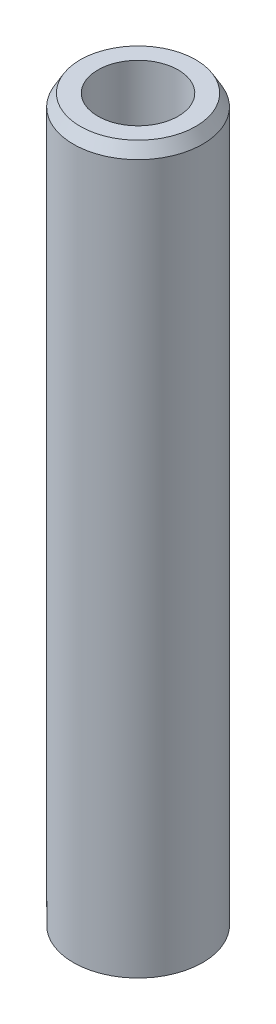
from build123d import *
from OCP.BRepFilletAPI import BRepFilletAPI_MakeChamfer

# Parameters (mm, degrees)
SKETCH1_R           = 25
BOSS_EXTRUDE1_DEPTH = 281.291442131
SKETCH2_R           = 15.524501488
CUT_EXTRUDE1_DEPTH  = 284.504630325
CHAMFER1_SIZE       = 4.627964847
CHAMFER1_SIZE2      = 2.67195675


with BuildPart() as part:
    # Sketch1 → Boss-Extrude1 (new body)
    with BuildSketch(Plane(origin=(0, 0, 0), x_dir=(1, 0, 0), z_dir=(0, 1, 0))):
        Circle(SKETCH1_R)
    extrude(amount=BOSS_EXTRUDE1_DEPTH)

    # Sketch2 → Cut-Extrude1 (cut, through all)
    with BuildSketch(Plane(origin=(0, 0, 0), x_dir=(1, 0, 0), z_dir=(0, 1, 0))):
        Circle(SKETCH2_R)
    extrude(amount=CUT_EXTRUDE1_DEPTH, mode=Mode.SUBTRACT)

    # Chamfer1: one chamfer whose edges measure the first distance from different faces: ONE call of the kernel's chamfer builder (chamfer() names one face for all edges)
    chamfer1_edges_1 = [part.edges().sort_by_distance(p)[0] for p in [
        (-25, 281.291442131, 0),
    ]]
    chamfer1_side_1 = [part.faces().sort_by_distance(p)[0] for p in [
        (-25, 140.645721065, 0),
    ]]
    chamfer1_edges_2 = [part.edges().sort_by_distance(p)[0] for p in [
        (-25, 0, 0),
    ]]
    chamfer1_side_2 = [part.faces().sort_by_distance(p)[0] for p in [
        (-24.292893219, 0, 0),
    ]]
    chamfer1 = BRepFilletAPI_MakeChamfer(part.part.solid().wrapped)
    for e in chamfer1_edges_1:
        chamfer1.Add(CHAMFER1_SIZE, CHAMFER1_SIZE2, e.wrapped, chamfer1_side_1[0].wrapped)  # the first distance lies on this face
    for e in chamfer1_edges_2:
        chamfer1.Add(CHAMFER1_SIZE, CHAMFER1_SIZE2, e.wrapped, chamfer1_side_2[0].wrapped)  # the first distance lies on this face
    add(Compound.cast(chamfer1.Shape()), mode=Mode.REPLACE)


solid = part.part
